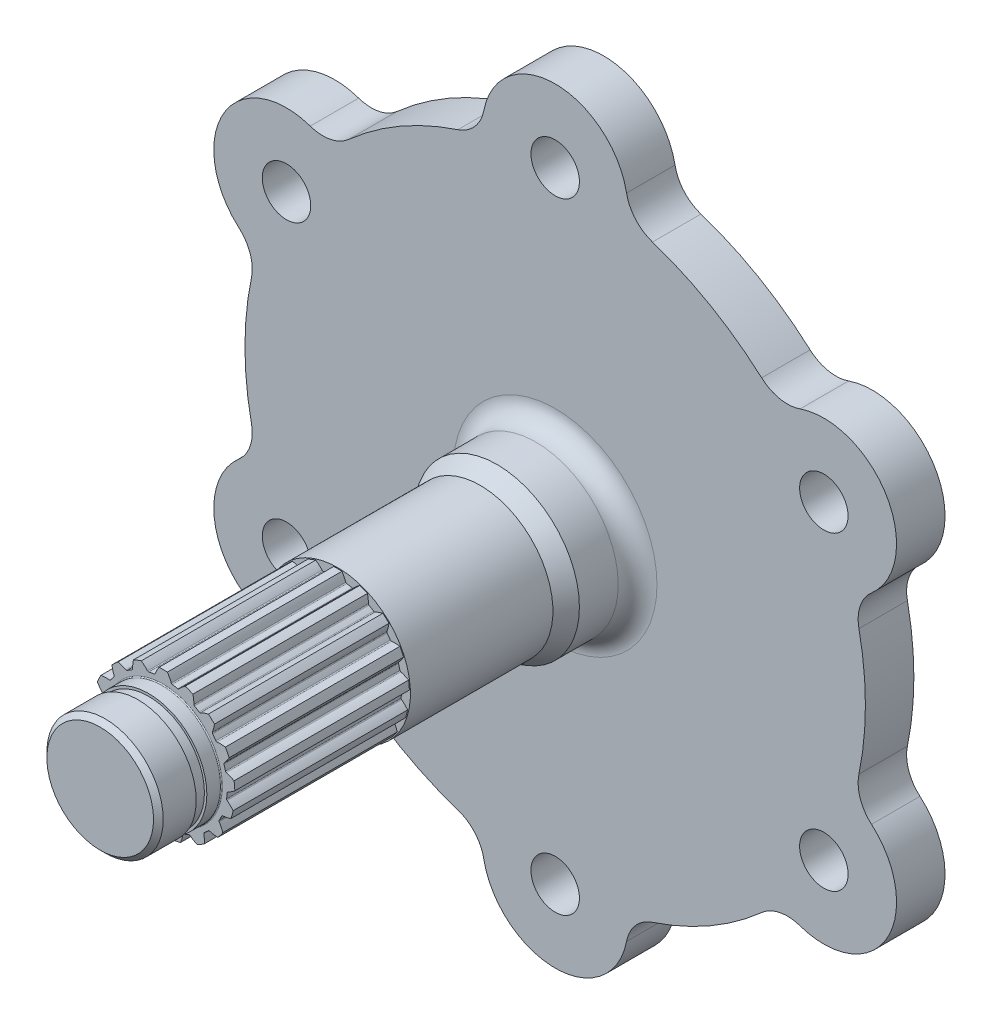
from build123d import *

# Parameters (mm, degrees)
SKETCH1_R           = 2.5
BOSS_EXTRUDE1_DEPTH = 5
SKETCH3_R           = 7.5
BOSS_EXTRUDE2_DEPTH = 22.43
BOSS_EXTRUDE7_DEPTH = 18
SKETCH4_R           = 6
BOSS_EXTRUDE3_DEPTH = 6.5
SKETCH6_R           = 8.5
BOSS_EXTRUDE5_DEPTH = 6
FILLET1_R           = 2
CHAMFER2_SIZE2      = 1.732050808
CHAMFER2_SIZE       = 1
CHAMFER3_SIZE       = 0.5
FILLET2_R           = 0.1
FILLET3_R           = 4
SKETCH12_W          = 1.1
SKETCH12_H          = 0.25
SKETCH13_R          = 24
SKETCH13_R_2        = 21
BOSS_EXTRUDE8_DEPTH = 4
CHAMFER4_SIZE       = 1


with BuildPart() as part:
    # Sketch1 → Boss-Extrude1 (new body)
    with BuildSketch(Plane.XY):
        with BuildLine():
            ThreePointArc((-7.448323557, 31.12109375), (-16, 27.712812921), (-23.227496003, 22.010984291))
            ThreePointArc((-23.227496003, 22.010984291), (-34.208003449, 19.75), (-30.675819559, 9.110109459))
            ThreePointArc((-30.675819559, 9.110109459), (-32, 0), (-30.675819559, -9.110109459))
            ThreePointArc((-30.675819559, -9.110109459), (-34.208003449, -19.75), (-23.227496003, -22.010984291))
            ThreePointArc((-23.227496003, -22.010984291), (-16, -27.712812921), (-7.448323557, -31.12109375))
            ThreePointArc((-7.448323557, -31.12109375), (0, -39.5), (7.448323557, -31.12109375))
            ThreePointArc((7.448323557, -31.12109375), (16, -27.712812921), (23.227496003, -22.010984291))
            ThreePointArc((23.227496003, -22.010984291), (34.208003449, -19.75), (30.675819559, -9.110109459))
            ThreePointArc((30.675819559, -9.110109459), (32, 0), (30.675819559, 9.110109459))
            ThreePointArc((30.675819559, 9.110109459), (34.208003449, 19.75), (23.227496003, 22.010984291))
            ThreePointArc((23.227496003, 22.010984291), (16, 27.712812921), (7.448323557, 31.12109375))
            ThreePointArc((7.448323557, 31.12109375), (0, 39.5), (-7.448323557, 31.12109375))
        make_face()
        with Locations((0, 32)):
            Circle(SKETCH1_R, mode=Mode.SUBTRACT)
        with Locations((27.712812921, 16)):
            Circle(SKETCH1_R, mode=Mode.SUBTRACT)
        with Locations((27.712812921, -16)):
            Circle(SKETCH1_R, mode=Mode.SUBTRACT)
        with Locations((0, -32)):
            Circle(SKETCH1_R, mode=Mode.SUBTRACT)
        with Locations((-27.712812921, -16)):
            Circle(SKETCH1_R, mode=Mode.SUBTRACT)
        with Locations((-27.712812921, 16)):
            Circle(SKETCH1_R, mode=Mode.SUBTRACT)
    extrude(amount=BOSS_EXTRUDE1_DEPTH)

    # Sketch3 → Boss-Extrude2 (add)
    with BuildSketch(Plane.XY.offset(5)):
        with Locations(Location((0, 0, 0), (0, 0, 180))):
            Circle(SKETCH3_R)
    extrude(amount=BOSS_EXTRUDE2_DEPTH)

    # Sketch9 → Boss-Extrude7 (add)
    with BuildSketch(Plane.XY.offset(27.43)):
        with BuildLine():
            ThreePointArc((3.065434453, 6.727003422), (2.670494178, 6.893324312), (2.266580134, 7.036481234))
            add(Edge.make_bspline(
                [(2.266580134, 7.036481234), (2.126818387, 6.938788398), (1.999963915, 6.840591067), (1.8857083, 6.743110628), (1.783612796, 6.647519469), (1.693117386, 6.554921304), (1.613554225, 6.466335435)],
                knots=[0, 0, 0, 0, 0, 0, 0, 1, 1, 1, 1, 1, 1, 1], degree=6))
            add(Edge.make_bspline(
                [(1.613554225, 6.466335435), (1.598164962, 6.44910015), (1.558045018, 6.423044176), (1.510221243, 6.420988968), (1.487755535, 6.426241211)],
                knots=[0, 0, 0, 0, 0.500434337, 1, 1, 1, 1], degree=3))
            ThreePointArc((1.487755535, 6.426241211), (1.350215953, 6.456539837), (1.212060845, 6.483895085))
            ThreePointArc((1.212060845, 6.483895085), (1.073353189, 6.508294458), (0.934156222, 6.529726857))
            add(Edge.make_bspline(
                [(0.934156222, 6.529726857), (0.911310245, 6.532944837), (0.867458329, 6.552137202), (0.839460099, 6.590926668), (0.831336141, 6.612557336)],
                knots=[0, 0, 0, 0, 0.499565663, 1, 1, 1, 1], degree=3))
            add(Edge.make_bspline(
                [(0.831336141, 6.612557336), (0.78914661, 6.723902728), (0.738212469, 6.842938658), (0.677542756, 6.968955909), (0.606216565, 7.101127601), (0.52340126, 7.238519005), (0.428368035, 7.380102628)],
                knots=[0, 0, 0, 0, 0, 0, 0, 1, 1, 1, 1, 1, 1, 1], degree=6))
            ThreePointArc((0.428368035, 7.380102628), (1.5161e-05, 7.392523356), (-0.428337714, 7.380102628))
            add(Edge.make_bspline(
                [(-0.428337714, 7.380102628), (-0.523370939, 7.238519005), (-0.606186244, 7.101127601), (-0.677512435, 6.968955909), (-0.738182148, 6.842938658), (-0.789116289, 6.723902728), (-0.83130582, 6.612557336)],
                knots=[0, 0, 0, 0, 0, 0, 0, 1, 1, 1, 1, 1, 1, 1], degree=6))
            add(Edge.make_bspline(
                [(-0.83130582, 6.612557336), (-0.839429778, 6.590926668), (-0.867428008, 6.552137202), (-0.911279924, 6.532944837), (-0.934125901, 6.529726857)],
                knots=[0, 0, 0, 0, 0.500434337, 1, 1, 1, 1], degree=3))
            ThreePointArc((-0.934125901, 6.529726857), (-1.073322868, 6.508294458), (-1.212030524, 6.483895085))
            ThreePointArc((-1.212030524, 6.483895085), (-1.350185632, 6.456539837), (-1.487725214, 6.426241211))
            add(Edge.make_bspline(
                [(-1.487725214, 6.426241211), (-1.510190921, 6.420988968), (-1.558014697, 6.423044176), (-1.598134641, 6.44910015), (-1.613523904, 6.466335435)],
                knots=[0, 0, 0, 0, 0.499565663, 1, 1, 1, 1], degree=3))
            add(Edge.make_bspline(
                [(-1.613523904, 6.466335435), (-1.693087065, 6.554921304), (-1.783582475, 6.647519469), (-1.885677979, 6.743110628), (-1.999933594, 6.840591067), (-2.126788065, 6.938788398), (-2.266549813, 7.036481234)],
                knots=[0, 0, 0, 0, 0, 0, 0, 1, 1, 1, 1, 1, 1, 1], degree=6))
            ThreePointArc((-2.266549813, 7.036481234), (-2.670463857, 6.893324312), (-3.065404132, 6.727003422))
            add(Edge.make_bspline(
                [(-3.065404132, 6.727003422), (-3.102874071, 6.560650664), (-3.130465543, 6.402620657), (-3.149229314, 6.253608232), (-3.160279454, 6.114184218), (-3.164773389, 5.984786985), (-3.16389136, 5.865719882)],
                knots=[0, 0, 0, 0, 0, 0, 0, 1, 1, 1, 1, 1, 1, 1], degree=6))
            add(Edge.make_bspline(
                [(-3.16389136, 5.865719882), (-3.163652827, 5.842615173), (-3.175748027, 5.796330945), (-3.209705639, 5.762593459), (-3.22984641, 5.751339864)],
                knots=[0, 0, 0, 0, 0.500434337, 1, 1, 1, 1], degree=3))
            ThreePointArc((-3.22984641, 5.751339864), (-3.35190144, 5.681071002), (-3.472428408, 5.60821228))
            ThreePointArc((-3.472428408, 5.60821228), (-3.591372354, 5.53279689), (-3.708679068, 5.454859234))
            add(Edge.make_bspline(
                [(-3.708679068, 5.454859234), (-3.727730388, 5.441846114), (-3.773067157, 5.426486598), (-3.819890394, 5.436290074), (-3.840466558, 5.446802256)],
                knots=[0, 0, 0, 0, 0.499565663, 1, 1, 1, 1], degree=3))
            add(Edge.make_bspline(
                [(-3.840466558, 5.446802256), (-3.946657903, 5.50066459), (-4.064492675, 5.554319095), (-4.194225406, 5.606574046), (-4.335979591, 5.65619796), (-4.48974083, 5.701939123), (-4.655355501, 5.742547213)],
                knots=[0, 0, 0, 0, 0, 0, 0, 1, 1, 1, 1, 1, 1, 1], degree=6))
            ThreePointArc((-4.655355501, 5.742547213), (-4.980279885, 5.463146776), (-5.288468689, 5.165388283))
            add(Edge.make_bspline(
                [(-5.288468689, 5.165388283), (-5.263314819, 4.996733253), (-5.231956077, 4.83940747), (-5.195623276, 4.693679266), (-5.155561462, 4.559678473), (-5.113008259, 4.437395751), (-5.069173793, 4.32668761)],
                knots=[0, 0, 0, 0, 0, 0, 0, 1, 1, 1, 1, 1, 1, 1], degree=6))
            add(Edge.make_bspline(
                [(-5.069173793, 4.32668761), (-5.060604983, 4.305229278), (-5.055163631, 4.257701231), (-5.074640775, 4.213975057), (-5.089356217, 4.196205707)],
                knots=[0, 0, 0, 0, 0.500434337, 1, 1, 1, 1], degree=3))
            ThreePointArc((-5.089356217, 4.196205707), (-5.177785103, 4.086590582), (-5.263853546, 3.975112484))
            ThreePointArc((-5.263853546, 3.975112484), (-5.347522292, 3.861822218), (-5.428753217, 3.746771446))
            add(Edge.make_bspline(
                [(-5.428753217, 3.746771446), (-5.441817162, 3.727754942), (-5.478543943, 3.69705509), (-5.525746735, 3.689282055), (-5.548730874, 3.691651405)],
                knots=[0, 0, 0, 0, 0.499565663, 1, 1, 1, 1], degree=3))
            add(Edge.make_bspline(
                [(-5.548730874, 3.691651405), (-5.667208674, 3.703515797), (-5.796468569, 3.710980303), (-5.936317404, 3.712841726), (-6.08642547, 3.70790713), (-6.246327169, 3.695014528), (-6.415427585, 3.673053525)],
                knots=[0, 0, 0, 0, 0, 0, 0, 1, 1, 1, 1, 1, 1, 1], degree=6))
            ThreePointArc((-6.415427585, 3.673053525), (-6.617479471, 3.295144151), (-6.797294197, 2.906161987))
            add(Edge.make_bspline(
                [(-6.797294197, 2.906161987), (-6.712913688, 2.757982481), (-6.626839904, 2.622608642), (-6.540317477, 2.499846061), (-6.454554278, 2.389366039), (-6.370700984, 2.290712786), (-6.289834168, 2.203315354)],
                knots=[0, 0, 0, 0, 0, 0, 0, 1, 1, 1, 1, 1, 1, 1], degree=6))
            add(Edge.make_bspline(
                [(-6.289834168, 2.203315354), (-6.274092348, 2.186401468), (-6.251849327, 2.144048526), (-6.254215507, 2.096239128), (-6.261518218, 2.074353871)],
                knots=[0, 0, 0, 0, 0.500434337, 1, 1, 1, 1], degree=3))
            ThreePointArc((-6.261518218, 2.074353871), (-6.304378148, 1.940196614), (-6.344364048, 1.805154875))
            ThreePointArc((-6.344364048, 1.805154875), (-6.381457665, 1.669290211), (-6.415642114, 1.532664566))
            add(Edge.make_bspline(
                [(-6.415642114, 1.532664566), (-6.420954327, 1.510212963), (-6.444110964, 1.46831896), (-6.485318313, 1.444019206), (-6.507606292, 1.43792573)],
                knots=[0, 0, 0, 0, 0.499565663, 1, 1, 1, 1], degree=3))
            add(Edge.make_bspline(
                [(-6.507606292, 1.43792573), (-6.622369463, 1.406189829), (-6.745597217, 1.366456213), (-6.876674795, 1.317672712), (-7.014863816, 1.258846051), (-7.159310365, 1.189060901), (-7.309058578, 1.107496759)],
                knots=[0, 0, 0, 0, 0, 0, 0, 1, 1, 1, 1, 1, 1, 1], degree=6))
            ThreePointArc((-7.309058578, 1.107496759), (-7.360949738, 0.682117203), (-7.388105412, 0.254445567))
            add(Edge.make_bspline(
                [(-7.388105412, 0.254445567), (-7.255894319, 0.146754048), (-7.126730234, 0.051615139), (-7.001703514, -0.031602053), (-6.881821726, -0.103640364), (-6.767993192, -0.165340479), (-6.661015539, -0.217623694)],
                knots=[0, 0, 0, 0, 0, 0, 0, 1, 1, 1, 1, 1, 1, 1], degree=6))
            add(Edge.make_bspline(
                [(-6.661015539, -0.217623694), (-6.640226728, -0.227708822), (-6.604186081, -0.259166658), (-6.589121731, -0.304602357), (-6.58802544, -0.327647795)],
                knots=[0, 0, 0, 0, 0.500434337, 1, 1, 1, 1], degree=3))
            ThreePointArc((-6.58802544, -0.327647795), (-6.579527943, -0.468228504), (-6.568030982, -0.608595748))
            ThreePointArc((-6.568030982, -0.608595748), (-6.553539772, -0.748685535), (-6.536060946, -0.888434001))
            add(Edge.make_bspline(
                [(-6.536060946, -0.888434001), (-6.532903982, -0.91128849), (-6.539363044, -0.958718627), (-6.569009669, -0.996263284), (-6.587591373, -1.009996628)],
                knots=[0, 0, 0, 0, 0.499565663, 1, 1, 1, 1], degree=3))
            add(Edge.make_bspline(
                [(-6.587591373, -1.009996628), (-6.683140513, -1.081046714), (-6.783693534, -1.162612206), (-6.888297102, -1.255452148), (-6.995903886, -1.360226009), (-7.105386977, -1.477478835), (-7.215558661, -1.607630426)],
                knots=[0, 0, 0, 0, 0, 0, 0, 1, 1, 1, 1, 1, 1, 1], degree=6))
            ThreePointArc((-7.215558661, -1.607630426), (-7.110280907, -2.023030298), (-6.981110004, -2.431631984))
            add(Edge.make_bspline(
                [(-6.981110004, -2.431631984), (-6.818924168, -2.484291179), (-6.664114108, -2.52634612), (-6.517468646, -2.55877898), (-6.379658968, -2.582646407), (-6.251228369, -2.599060442), (-6.132587803, -2.609168302)],
                knots=[0, 0, 0, 0, 0, 0, 0, 1, 1, 1, 1, 1, 1, 1], degree=6))
            add(Edge.make_bspline(
                [(-6.132587803, -2.609168302), (-6.109559645, -2.611062619), (-6.064588862, -2.627376794), (-6.034128507, -2.664302451), (-6.024781274, -2.685395656)],
                knots=[0, 0, 0, 0, 0.500434337, 1, 1, 1, 1], degree=3))
            ThreePointArc((-6.024781274, -2.685395656), (-5.966073984, -2.813413613), (-5.904646889, -2.940148989))
            ThreePointArc((-5.904646889, -2.940148989), (-5.840527971, -3.065543996), (-5.773746482, -3.18954148))
            add(Edge.make_bspline(
                [(-5.773746482, -3.18954148), (-5.762546707, -3.209712229), (-5.751435862, -3.256272797), (-5.765517821, -3.301991743), (-5.777883689, -3.321510191)],
                knots=[0, 0, 0, 0, 0.499565663, 1, 1, 1, 1], degree=3))
            add(Edge.make_bspline(
                [(-5.777883689, -3.321510191), (-5.841314357, -3.422278753), (-5.905612402, -3.53466025), (-5.969614669, -3.659018086), (-6.032106322, -3.795588855), (-6.091839658, -3.944473714), (-6.147555516, -4.10563506)],
                knots=[0, 0, 0, 0, 0, 0, 0, 1, 1, 1, 1, 1, 1, 1], degree=6))
            ThreePointArc((-6.147555516, -4.10563506), (-5.899327192, -4.454953194), (-5.631274959, -4.789301006))
            add(Edge.make_bspline(
                [(-5.631274959, -4.789301006), (-5.461018475, -4.779815961), (-5.301470397, -4.763107182), (-5.153011476, -4.740375472), (-5.015885869, -4.712848588), (-4.890198468, -4.681759736), (-4.775918055, -4.648327119)],
                knots=[0, 0, 0, 0, 0, 0, 0, 1, 1, 1, 1, 1, 1, 1], degree=6))
            add(Edge.make_bspline(
                [(-4.775918055, -4.648327119), (-4.753760631, -4.641774787), (-4.705933265, -4.640741981), (-4.664190744, -4.664170582), (-4.647854964, -4.680462799)],
                knots=[0, 0, 0, 0, 0.500434337, 1, 1, 1, 1], degree=3))
            ThreePointArc((-4.647854964, -4.680462799), (-4.546866626, -4.77862847), (-4.443805468, -4.874615663))
            ThreePointArc((-4.443805468, -4.874615663), (-4.338718456, -4.968380599), (-4.231653514, -5.059880553))
            add(Edge.make_bspline(
                [(-4.231653514, -5.059880553), (-4.213923521, -5.074643391), (-4.186743349, -5.114046128), (-4.183358796, -5.161764766), (-4.187838748, -5.184432243)],
                knots=[0, 0, 0, 0, 0.499565663, 1, 1, 1, 1], degree=3))
            add(Edge.make_bspline(
                [(-4.187838748, -5.184432243), (-4.210584281, -5.301309929), (-4.229943543, -5.429329687), (-4.244700648, -5.568410201), (-4.253637327, -5.718333239), (-4.25555359, -5.878742405), (-4.249288887, -6.049147774)],
                knots=[0, 0, 0, 0, 0, 0, 0, 1, 1, 1, 1, 1, 1, 1], degree=6))
            ThreePointArc((-4.249288887, -6.049147774), (-3.891634603, -6.28520682), (-3.520902979, -6.500145235))
            add(Edge.make_bspline(
                [(-3.520902979, -6.500145235), (-3.36556993, -6.429796958), (-3.222831684, -6.356581072), (-3.092609504, -6.281754836), (-2.974687541, -6.206551298), (-2.86871812, -6.132158281), (-2.774232062, -6.059700447)],
                knots=[0, 0, 0, 0, 0, 0, 0, 1, 1, 1, 1, 1, 1, 1], degree=6))
            add(Edge.make_bspline(
                [(-2.774232062, -6.059700447), (-2.755937855, -6.045586395), (-2.711713256, -6.027346094), (-2.664326128, -6.034113476), (-2.643208039, -6.043404352)],
                knots=[0, 0, 0, 0, 0.500434337, 1, 1, 1, 1], degree=3))
            ThreePointArc((-2.643208039, -6.043404352), (-2.513577688, -6.098459919), (-2.382801447, -6.150735325))
            ThreePointArc((-2.382801447, -6.150735325), (-2.250938925, -6.200206717), (-2.118050244, -6.246851565))
            add(Edge.make_bspline(
                [(-2.118050244, -6.246851565), (-2.096184565, -6.25421269), (-2.0566059, -6.281136037), (-2.036211938, -6.3244097), (-2.032200931, -6.347164838)],
                knots=[0, 0, 0, 0, 0.499565663, 1, 1, 1, 1], degree=3))
            add(Edge.make_bspline(
                [(-2.032200931, -6.347164838), (-2.011189419, -6.464366669), (-1.982995323, -6.59073491), (-1.946514237, -6.725754508), (-1.900688994, -6.868781879), (-1.844529381, -7.019051206), (-1.7771302, -7.175686408)],
                knots=[0, 0, 0, 0, 0, 0, 0, 1, 1, 1, 1, 1, 1, 1], degree=6))
            ThreePointArc((-1.7771302, -7.175686408), (-1.35835315, -7.266605284), (-0.935011495, -7.333105676))
            add(Edge.make_bspline(
                [(-0.935011495, -7.333105676), (-0.815580468, -7.211395092), (-0.708929647, -7.09156031), (-0.614531435, -6.974745246), (-0.53173913, -6.862021709), (-0.459799445, -6.754371716), (-0.397868609, -6.652674497)],
                knots=[0, 0, 0, 0, 0, 0, 0, 1, 1, 1, 1, 1, 1, 1], degree=6))
            add(Edge.make_bspline(
                [(-0.397868609, -6.652674497), (-0.385908352, -6.632904905), (-0.351259299, -6.599920564), (-0.304627458, -6.589112754), (-0.281579175, -6.590147505)],
                knots=[0, 0, 0, 0, 0.500434337, 1, 1, 1, 1], degree=3))
            ThreePointArc((-0.281579175, -6.590147505), (-0.140814107, -6.594657408), (1.5161e-05, -6.596160946))
            ThreePointArc((1.5161e-05, -6.596160946), (0.140844429, -6.594657408), (0.281609496, -6.590147505))
            add(Edge.make_bspline(
                [(0.281609496, -6.590147505), (0.304657779, -6.589112754), (0.35128962, -6.599920564), (0.385938673, -6.632904905), (0.39789893, -6.652674497)],
                knots=[0, 0, 0, 0, 0.499565663, 1, 1, 1, 1], degree=3))
            add(Edge.make_bspline(
                [(0.39789893, -6.652674497), (0.459829766, -6.754371716), (0.531769452, -6.862021709), (0.614561756, -6.974745246), (0.708959968, -7.09156031), (0.815610789, -7.211395092), (0.935041816, -7.333105676)],
                knots=[0, 0, 0, 0, 0, 0, 0, 1, 1, 1, 1, 1, 1, 1], degree=6))
            ThreePointArc((0.935041816, -7.333105676), (1.358383471, -7.266605284), (1.777160521, -7.175686408))
            add(Edge.make_bspline(
                [(1.777160521, -7.175686408), (1.844559702, -7.019051206), (1.900719315, -6.868781879), (1.946544558, -6.725754508), (1.983025644, -6.59073491), (2.01121974, -6.464366669), (2.032231252, -6.347164838)],
                knots=[0, 0, 0, 0, 0, 0, 0, 1, 1, 1, 1, 1, 1, 1], degree=6))
            add(Edge.make_bspline(
                [(2.032231252, -6.347164838), (2.036242259, -6.3244097), (2.056636221, -6.281136037), (2.096214886, -6.25421269), (2.118080565, -6.246851565)],
                knots=[0, 0, 0, 0, 0.500434337, 1, 1, 1, 1], degree=3))
            ThreePointArc((2.118080565, -6.246851565), (2.250969246, -6.200206717), (2.382831768, -6.150735325))
            ThreePointArc((2.382831768, -6.150735325), (2.513608009, -6.098459919), (2.64323836, -6.043404352))
            add(Edge.make_bspline(
                [(2.64323836, -6.043404352), (2.664356449, -6.034113476), (2.711743578, -6.027346094), (2.755968176, -6.045586395), (2.774262383, -6.059700447)],
                knots=[0, 0, 0, 0, 0.499565663, 1, 1, 1, 1], degree=3))
            add(Edge.make_bspline(
                [(2.774262383, -6.059700447), (2.868748441, -6.132158281), (2.974717862, -6.206551298), (3.092639825, -6.281754836), (3.222862005, -6.356581072), (3.365600251, -6.429796958), (3.5209333, -6.500145235)],
                knots=[0, 0, 0, 0, 0, 0, 0, 1, 1, 1, 1, 1, 1, 1], degree=6))
            ThreePointArc((3.5209333, -6.500145235), (3.891664925, -6.28520682), (4.249319208, -6.049147774))
            add(Edge.make_bspline(
                [(4.249319208, -6.049147774), (4.255583911, -5.878742405), (4.253667648, -5.718333239), (4.244730969, -5.568410201), (4.229973864, -5.429329687), (4.210614602, -5.301309929), (4.187869069, -5.184432243)],
                knots=[0, 0, 0, 0, 0, 0, 0, 1, 1, 1, 1, 1, 1, 1], degree=6))
            add(Edge.make_bspline(
                [(4.187869069, -5.184432243), (4.183389118, -5.161764766), (4.18677367, -5.114046128), (4.213953842, -5.074643391), (4.231683835, -5.059880553)],
                knots=[0, 0, 0, 0, 0.500434337, 1, 1, 1, 1], degree=3))
            ThreePointArc((4.231683835, -5.059880553), (4.338748777, -4.968380599), (4.443835789, -4.874615663))
            ThreePointArc((4.443835789, -4.874615663), (4.546896947, -4.77862847), (4.647885285, -4.680462799))
            add(Edge.make_bspline(
                [(4.647885285, -4.680462799), (4.664221065, -4.664170582), (4.705963586, -4.640741981), (4.753790952, -4.641774787), (4.775948376, -4.648327119)],
                knots=[0, 0, 0, 0, 0.499565663, 1, 1, 1, 1], degree=3))
            add(Edge.make_bspline(
                [(4.775948376, -4.648327119), (4.89022879, -4.681759736), (5.01591619, -4.712848588), (5.153041797, -4.740375472), (5.301500718, -4.763107182), (5.461048796, -4.779815961), (5.63130528, -4.789301006)],
                knots=[0, 0, 0, 0, 0, 0, 0, 1, 1, 1, 1, 1, 1, 1], degree=6))
            ThreePointArc((5.63130528, -4.789301006), (5.899357513, -4.454953194), (6.147585837, -4.10563506))
            add(Edge.make_bspline(
                [(6.147585837, -4.10563506), (6.09186998, -3.944473714), (6.032136643, -3.795588855), (5.96964499, -3.659018086), (5.905642723, -3.53466025), (5.841344678, -3.422278753), (5.77791401, -3.321510191)],
                knots=[0, 0, 0, 0, 0, 0, 0, 1, 1, 1, 1, 1, 1, 1], degree=6))
            add(Edge.make_bspline(
                [(5.77791401, -3.321510191), (5.765548142, -3.301991743), (5.751466183, -3.256272797), (5.762577029, -3.209712229), (5.773776803, -3.18954148)],
                knots=[0, 0, 0, 0, 0.500434337, 1, 1, 1, 1], degree=3))
            ThreePointArc((5.773776803, -3.18954148), (5.840558292, -3.065543996), (5.90467721, -2.940148989))
            ThreePointArc((5.90467721, -2.940148989), (5.966104305, -2.813413613), (6.024811595, -2.685395656))
            add(Edge.make_bspline(
                [(6.024811595, -2.685395656), (6.034158828, -2.664302451), (6.064619183, -2.627376794), (6.109589966, -2.611062619), (6.132618124, -2.609168302)],
                knots=[0, 0, 0, 0, 0.499565663, 1, 1, 1, 1], degree=3))
            add(Edge.make_bspline(
                [(6.132618124, -2.609168302), (6.25125869, -2.599060442), (6.37968929, -2.582646407), (6.517498968, -2.55877898), (6.664144429, -2.52634612), (6.818954489, -2.484291179), (6.981140325, -2.431631984)],
                knots=[0, 0, 0, 0, 0, 0, 0, 1, 1, 1, 1, 1, 1, 1], degree=6))
            ThreePointArc((6.981140325, -2.431631984), (7.110311228, -2.023030298), (7.215588982, -1.607630426))
            add(Edge.make_bspline(
                [(7.215588982, -1.607630426), (7.105417298, -1.477478835), (6.995934207, -1.360226009), (6.888327423, -1.255452148), (6.783723855, -1.162612206), (6.683170834, -1.081046714), (6.587621694, -1.009996628)],
                knots=[0, 0, 0, 0, 0, 0, 0, 1, 1, 1, 1, 1, 1, 1], degree=6))
            add(Edge.make_bspline(
                [(6.587621694, -1.009996628), (6.56903999, -0.996263284), (6.539393366, -0.958718627), (6.532934303, -0.91128849), (6.536091267, -0.888434001)],
                knots=[0, 0, 0, 0, 0.500434337, 1, 1, 1, 1], degree=3))
            ThreePointArc((6.536091267, -0.888434001), (6.553570093, -0.748685535), (6.568061303, -0.608595748))
            ThreePointArc((6.568061303, -0.608595748), (6.579558264, -0.468228504), (6.588055761, -0.327647795))
            add(Edge.make_bspline(
                [(6.588055761, -0.327647795), (6.589152053, -0.304602357), (6.604216402, -0.259166658), (6.640257049, -0.227708822), (6.66104586, -0.217623694)],
                knots=[0, 0, 0, 0, 0.499565663, 1, 1, 1, 1], degree=3))
            add(Edge.make_bspline(
                [(6.66104586, -0.217623694), (6.768023513, -0.165340479), (6.881852047, -0.103640364), (7.001733835, -0.031602053), (7.126760555, 0.051615139), (7.25592464, 0.146754048), (7.388135733, 0.254445567)],
                knots=[0, 0, 0, 0, 0, 0, 0, 1, 1, 1, 1, 1, 1, 1], degree=6))
            ThreePointArc((7.388135733, 0.254445567), (7.360980059, 0.682117203), (7.309088899, 1.107496759))
            add(Edge.make_bspline(
                [(7.309088899, 1.107496759), (7.159340686, 1.189060901), (7.014894137, 1.258846051), (6.876705116, 1.317672712), (6.745627538, 1.366456213), (6.622399784, 1.406189829), (6.507636614, 1.43792573)],
                knots=[0, 0, 0, 0, 0, 0, 0, 1, 1, 1, 1, 1, 1, 1], degree=6))
            add(Edge.make_bspline(
                [(6.507636614, 1.43792573), (6.485348634, 1.444019206), (6.444141286, 1.46831896), (6.420984648, 1.510212963), (6.415672435, 1.532664566)],
                knots=[0, 0, 0, 0, 0.500434337, 1, 1, 1, 1], degree=3))
            ThreePointArc((6.415672435, 1.532664566), (6.381487986, 1.669290211), (6.344394369, 1.805154875))
            ThreePointArc((6.344394369, 1.805154875), (6.304408469, 1.940196614), (6.261548539, 2.074353871))
            add(Edge.make_bspline(
                [(6.261548539, 2.074353871), (6.254245828, 2.096239128), (6.251879648, 2.144048526), (6.274122669, 2.186401468), (6.28986449, 2.203315354)],
                knots=[0, 0, 0, 0, 0.499565663, 1, 1, 1, 1], degree=3))
            add(Edge.make_bspline(
                [(6.28986449, 2.203315354), (6.370731305, 2.290712786), (6.454584599, 2.389366039), (6.540347798, 2.499846061), (6.626870226, 2.622608642), (6.712944009, 2.757982481), (6.797324518, 2.906161987)],
                knots=[0, 0, 0, 0, 0, 0, 0, 1, 1, 1, 1, 1, 1, 1], degree=6))
            ThreePointArc((6.797324518, 2.906161987), (6.617509792, 3.295144151), (6.415457907, 3.673053525))
            add(Edge.make_bspline(
                [(6.415457907, 3.673053525), (6.246357491, 3.695014528), (6.086455791, 3.70790713), (5.936347725, 3.712841726), (5.79649889, 3.710980303), (5.667238995, 3.703515797), (5.548761195, 3.691651405)],
                knots=[0, 0, 0, 0, 0, 0, 0, 1, 1, 1, 1, 1, 1, 1], degree=6))
            add(Edge.make_bspline(
                [(5.548761195, 3.691651405), (5.525777056, 3.689282055), (5.478574264, 3.69705509), (5.441847483, 3.727754942), (5.428783538, 3.746771446)],
                knots=[0, 0, 0, 0, 0.500434337, 1, 1, 1, 1], degree=3))
            ThreePointArc((5.428783538, 3.746771446), (5.347552613, 3.861822218), (5.263883868, 3.975112484))
            ThreePointArc((5.263883868, 3.975112484), (5.177815424, 4.086590582), (5.089386538, 4.196205707))
            add(Edge.make_bspline(
                [(5.089386538, 4.196205707), (5.074671096, 4.213975057), (5.055193952, 4.257701231), (5.060635305, 4.305229278), (5.069204114, 4.32668761)],
                knots=[0, 0, 0, 0, 0.499565663, 1, 1, 1, 1], degree=3))
            add(Edge.make_bspline(
                [(5.069204114, 4.32668761), (5.11303858, 4.437395751), (5.155591783, 4.559678473), (5.195653597, 4.693679266), (5.231986399, 4.83940747), (5.26334514, 4.996733253), (5.28849901, 5.165388283)],
                knots=[0, 0, 0, 0, 0, 0, 0, 1, 1, 1, 1, 1, 1, 1], degree=6))
            ThreePointArc((5.28849901, 5.165388283), (4.980310206, 5.463146776), (4.655385822, 5.742547213))
            add(Edge.make_bspline(
                [(4.655385822, 5.742547213), (4.489771151, 5.701939123), (4.336009912, 5.65619796), (4.194255727, 5.606574046), (4.064522996, 5.554319095), (3.946688224, 5.50066459), (3.840496879, 5.446802256)],
                knots=[0, 0, 0, 0, 0, 0, 0, 1, 1, 1, 1, 1, 1, 1], degree=6))
            add(Edge.make_bspline(
                [(3.840496879, 5.446802256), (3.819920715, 5.436290074), (3.773097478, 5.426486598), (3.727760709, 5.441846114), (3.70870939, 5.454859234)],
                knots=[0, 0, 0, 0, 0.500434337, 1, 1, 1, 1], degree=3))
            ThreePointArc((3.70870939, 5.454859234), (3.591402675, 5.53279689), (3.472458729, 5.60821228))
            ThreePointArc((3.472458729, 5.60821228), (3.351931762, 5.681071002), (3.229876731, 5.751339864))
            add(Edge.make_bspline(
                [(3.229876731, 5.751339864), (3.20973596, 5.762593459), (3.175778349, 5.796330945), (3.163683148, 5.842615173), (3.163921682, 5.865719882)],
                knots=[0, 0, 0, 0, 0.499565663, 1, 1, 1, 1], degree=3))
            add(Edge.make_bspline(
                [(3.163921682, 5.865719882), (3.16480371, 5.984786985), (3.160309776, 6.114184218), (3.149259635, 6.253608232), (3.130495865, 6.402620657), (3.102904392, 6.560650664), (3.065434453, 6.727003422)],
                knots=[0, 0, 0, 0, 0, 0, 0, 1, 1, 1, 1, 1, 1, 1], degree=6))
        make_face()
    extrude(amount=BOSS_EXTRUDE7_DEPTH)

    # Sketch4 → Boss-Extrude3 (add)
    with BuildSketch(Plane.XY.offset(45.43)):
        Circle(SKETCH4_R)
    extrude(amount=BOSS_EXTRUDE3_DEPTH)

    # Sketch6 → Boss-Extrude5 (add)
    with BuildSketch(Plane.XY.offset(5)):
        Circle(SKETCH6_R)
    extrude(amount=BOSS_EXTRUDE5_DEPTH)

    # Fillet1
    fillet1_edges = [part.edges().sort_by_distance(p)[0] for p in [
        (-8.5, 0, 5),
    ]]
    fillet(fillet1_edges, radius=FILLET1_R)

    # Chamfer2
    chamfer2_edges = [part.edges().sort_by_distance(p)[0] for p in [
        (7.5, 0, 11),
    ]]
    chamfer2_side = [part.faces().sort_by_distance(p)[0] for p in [
        (7.52, 0, 11),
    ]]
    chamfer(chamfer2_edges, length=CHAMFER2_SIZE - 0.0001, length2=CHAMFER2_SIZE2 - 0.0001, reference=chamfer2_side[0])  # a hair under: the kernel refuses the full size

    # Chamfer3
    chamfer3_edges = [part.edges().sort_by_distance(p)[0] for p in [
        (-6, 0, 51.93),
    ]]
    chamfer(chamfer3_edges, length=CHAMFER3_SIZE)

    # Fillet2
    fillet2_edges = [part.edges().sort_by_distance(p)[0] for p in [
        (-6, 0, 45.43),
    ]]
    fillet(fillet2_edges, radius=FILLET2_R)

    # Fillet3
    fillet3_edges = [part.edges().sort_by_distance(p)[0] for p in [
        (30.675819559, 9.110109459, 2.5),
        (30.675819559, -9.110109459, 2.5),
        (23.227496003, -22.010984291, 2.5),
        (7.448323557, -31.12109375, 2.5),
        (-7.448323557, -31.12109375, 2.5),
        (-23.227496003, -22.010984291, 2.5),
        (-30.675819559, -9.110109459, 2.5),
        (-30.675819559, 9.110109459, 2.5),
        (-23.227496003, 22.010984291, 2.5),
        (-7.448323557, 31.12109375, 2.5),
        (7.448323557, 31.12109375, 2.5),
        (23.227496003, 22.010984291, 2.5),
    ]]
    fillet(fillet3_edges, radius=FILLET3_R)

    # Sketch12 → Cut-Revolve1 (revolve, cut)
    with BuildSketch(Plane(origin=(0, 0, 0), x_dir=(0, 0, -1), z_dir=(1, 0, 0)), mode=Mode.PRIVATE) as cut_revolve1_sk:
        with Locations((-47.48, 5.875)):
            Rectangle(SKETCH12_W, SKETCH12_H)
    revolve(cut_revolve1_sk.sketch.rotate(Axis((0, 0, 51.93), (0, 0, -1)), 90), axis=Axis((0, 0, 51.93), (0, 0, -1)), mode=Mode.SUBTRACT)

    # Sketch13 → Boss-Extrude8 (add)
    with BuildSketch(Plane(origin=(0, 0, 0), x_dir=(-1, 0, 0), z_dir=(0, 0, -1))):
        with Locations(Location((0, 0, 0), (0, 0, 180))):
            Circle(SKETCH13_R)
        Circle(SKETCH13_R_2, mode=Mode.SUBTRACT)
    extrude(amount=BOSS_EXTRUDE8_DEPTH)

    # Chamfer4
    chamfer4_edges = [part.edges().sort_by_distance(p)[0] for p in [
        (-24, 0, -4),
        (21, 0, 0),
    ]]
    chamfer(chamfer4_edges, length=CHAMFER4_SIZE)


solid = part.part
